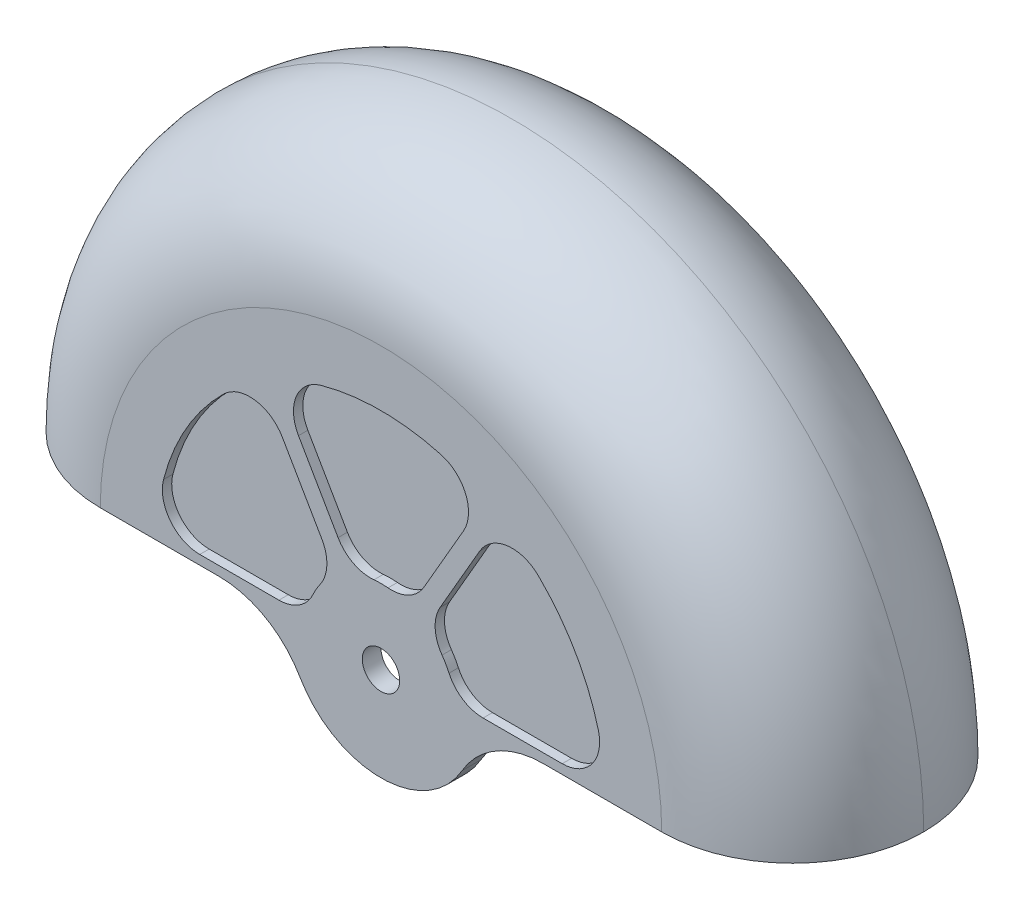
from build123d import *

# Parameters (mm, degrees)
SKETCH1_R      = 110
EXTRUDE1_DEPTH = 70
FILLET1_R      = 35
EXTRUDE2_DEPTH = 171.587221092
SKETCH3_R      = 5
EXTRUDE3_DEPTH = 171.587221262
EXTRUDE7_DEPTH = 2.5


# Read off the part's stored shape, not the designer's step: Shell1
with BuildPart() as part:
    # Sketch1 → Extrude1 (new body)
    with BuildSketch(Plane.XY):
        Circle(SKETCH1_R)
    extrude(amount=EXTRUDE1_DEPTH)

    # Fillet1
    fillet1_edges = [part.edges().sort_by_distance(p)[0] for p in [
        (-110, 0, 0),
        (-110, 0, 70),
    ]]
    fillet(fillet1_edges, radius=FILLET1_R - 0.0001)  # a hair under: the kernel refuses the full size

    # Sketch2 → Extrude2 (cut, through all)
    with BuildSketch(Plane.XY):
        with BuildLine():
            Line((43.301270189, 0), (110, 0))
            Line((110, 0), (110, -110))
            Line((110, -110), (-110, -110))
            Line((-110, -110), (-110, 0))
            Line((-110, 0), (-43.301270189, 0))
            ThreePointArc((-43.301270189, 0), (-30.801270189, -3.349364905), (-21.650635095, -12.5))
            ThreePointArc((-21.650635095, -12.5), (0, -25), (21.650635095, -12.5))
            ThreePointArc((21.650635095, -12.5), (30.801270189, -3.349364905), (43.301270189, 0))
        make_face()
    extrude(amount=EXTRUDE2_DEPTH, mode=Mode.SUBTRACT)

    # Shell1 outline → Shell1 (revolve, cut)
    with BuildSketch(Plane.XZ):
        with BuildLine():
            Line((0, 65), (0, 5))
            Line((0, 5), (75, 5))
            ThreePointArc((75, 5), (96.213203436, 13.786796564), (105, 35))
            ThreePointArc((105, 35), (96.213203436, 56.213203436), (75, 65))
            Line((75, 65), (0, 65))
        make_face()
    revolve(axis=Axis((0, 0, 0), (0, 0, 1)), mode=Mode.SUBTRACT)

    # Sketch3 → Extrude3 (cut, through all)
    with BuildSketch(Plane.XY.offset(70)):
        Circle(SKETCH3_R)
    extrude(amount=-EXTRUDE3_DEPTH, mode=Mode.SUBTRACT)

    # Sketch5 → Extrude7 (cut)
    with BuildSketch(Plane.XY.offset(70)):
        with BuildLine():
            Line((-27.271780287, 2.5), (-48.412291828, 2.5))
            ThreePointArc((-48.412291828, 2.5), (-56.317985978, 6.376275643), (-58.094750193, 15))
            ThreePointArc((-58.094750193, 15), (-51.961524227, 30), (-42.037756153, 42.811529494))
            ThreePointArc((-42.037756153, 42.811529494), (-33.681009677, 45.584668725), (-26.371209423, 40.676274578))
            Line((-26.371209423, 40.676274578), (-15.800953653, 22.368054535))
            ThreePointArc((-15.800953653, 22.368054535), (-14.472209198, 16.899109859), (-16.307471794, 11.578703023))
            ThreePointArc((-16.307471794, 11.578703023), (-17.320508076, 10), (-18.181186858, 8.333333333))
            ThreePointArc((-18.181186858, 8.333333333), (-21.871163038, 4.083745885), (-27.271780287, 2.5))
        make_face()
        with BuildLine():
            Line((-11.470826634, 24.868054535), (-22.041082404, 43.176274578))
            ThreePointArc((-22.041082404, 43.176274578), (-22.636976301, 51.960944368), (-16.05699404, 57.811529494))
            ThreePointArc((-16.05699404, 57.811529494), (0, 60), (16.05699404, 57.811529494))
            ThreePointArc((16.05699404, 57.811529494), (22.636976301, 51.960944368), (22.041082404, 43.176274578))
            Line((22.041082404, 43.176274578), (11.470826634, 24.868054535))
            ThreePointArc((11.470826634, 24.868054535), (7.39895384, 20.982855743), (1.873715064, 19.912036356))
            ThreePointArc((1.873715064, 19.912036356), (0, 20), (-1.873715064, 19.912036356))
            ThreePointArc((-1.873715064, 19.912036356), (-7.39895384, 20.982855743), (-11.470826634, 24.868054535))
        make_face()
        with BuildLine():
            Line((27.271780287, 2.5), (48.412291828, 2.5))
            ThreePointArc((48.412291828, 2.5), (56.317985978, 6.376275643), (58.094750193, 15))
            ThreePointArc((58.094750193, 15), (51.961524227, 30), (42.037756153, 42.811529494))
            ThreePointArc((42.037756153, 42.811529494), (33.681009677, 45.584668725), (26.371209423, 40.676274578))
            Line((26.371209423, 40.676274578), (15.800953653, 22.368054535))
            ThreePointArc((15.800953653, 22.368054535), (14.472209198, 16.899109859), (16.307471794, 11.578703023))
            ThreePointArc((16.307471794, 11.578703023), (17.320508076, 10), (18.181186858, 8.333333333))
            ThreePointArc((18.181186858, 8.333333333), (21.871163038, 4.083745885), (27.271780287, 2.5))
        make_face()
    extrude(amount=-EXTRUDE7_DEPTH, mode=Mode.SUBTRACT)


solid = part.part
